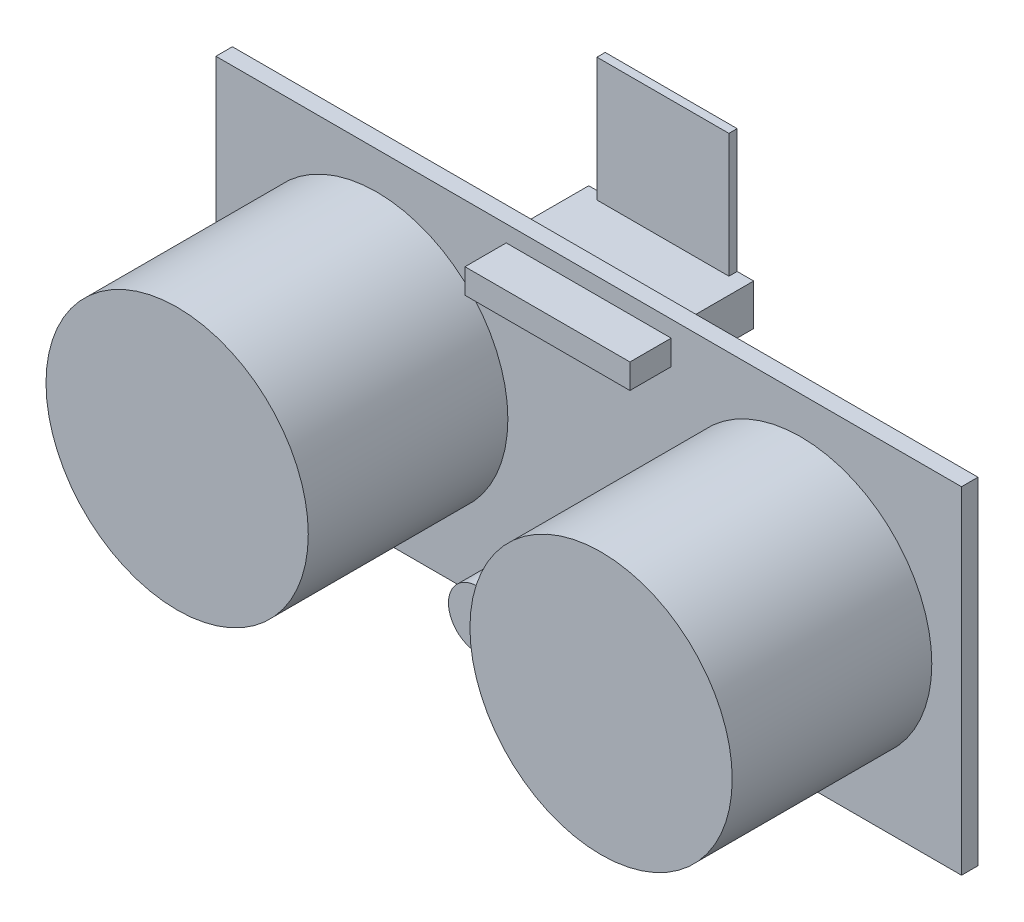
from build123d import *

# Parameters (mm, degrees)
ESBO_O1_W                = 45.2
ESBO_O1_H                = 20.4
RESSALTO_EXTRUS_O1_DEPTH = 1
ESBO_O2_R                = 7.95
RESSALTO_EXTRUS_O2_DEPTH = 12.1
ESBO_O3_W                = 10
ESBO_O3_H                = 3.5
RESSALTO_EXTRUS_O3_DEPTH = 3.5
FILETE1_R                = 1.75
ESBO_O4_W                = 10
ESBO_O4_H                = 2.5
RESSALTO_EXTRUS_O4_DEPTH = 4
ESBO_O5_W                = 8
ESBO_O5_H                = 0.5
RESSALTO_EXTRUS_O5_DEPTH = 7.5
ESBO_O7_W                = 10
ESBO_O7_H                = 1.5
RESSALTO_EXTRUS_O6_DEPTH = 2.5


with BuildPart() as part:
    # Esboço1 → Ressalto-extrusão1 (new body)
    with BuildSketch(Plane.XY):
        with Locations((22.6, 10.2)):
            Rectangle(ESBO_O1_W, ESBO_O1_H)
    extrude(amount=RESSALTO_EXTRUS_O1_DEPTH)

    # Esboço2 → Ressalto-extrusão2 (add)
    with BuildSketch(Plane.XY.offset(1)):
        with Locations(Location((9.75, 10.2, 0), (0, 0, 180))):
            Circle(ESBO_O2_R)
        with Locations(Location((35.45, 10.2, 0), (0, 0, 180))):
            Circle(ESBO_O2_R)
    extrude(amount=RESSALTO_EXTRUS_O2_DEPTH)

    # Esboço3 → Ressalto-extrusão3 (add)
    with BuildSketch(Plane.XY.offset(1)):
        with Locations((22.6, 2.25)):
            Rectangle(ESBO_O3_W, ESBO_O3_H)
    extrude(amount=RESSALTO_EXTRUS_O3_DEPTH)

    # Filete1
    filete1_edges = [part.edges().sort_by_distance(p)[0] for p in [
        (27.6, 0.5, 2.75),
        (27.6, 4, 2.75),
        (17.6, 4, 2.75),
        (17.6, 0.5, 2.75),
    ]]
    fillet(filete1_edges, radius=FILETE1_R - 0.0001)  # a hair under: the kernel refuses the full size

    # Esboço4 → Ressalto-extrusão4 (add)
    with BuildSketch(Plane(origin=(0, 0, 0), x_dir=(-1, 0, 0), z_dir=(0, 0, -1))):
        with Locations((-22.6, 18.651439954)):
            Rectangle(ESBO_O4_W, ESBO_O4_H)
    extrude(amount=RESSALTO_EXTRUS_O4_DEPTH)

    # Esboço5 → Ressalto-extrusão5 (add)
    with BuildSketch(Plane(origin=(0, 19.901439954, 0), x_dir=(1, 0, 0), z_dir=(0, 1, 0))):
        with Locations((22.6, 3.75)):
            Rectangle(ESBO_O5_W, ESBO_O5_H)
    extrude(amount=RESSALTO_EXTRUS_O5_DEPTH)

    # Esboço7 → Ressalto-extrusão6 (add)
    with BuildSketch(Plane.XY.offset(1)):
        with Locations((22.6, 18.65)):
            Rectangle(ESBO_O7_W, ESBO_O7_H)
    extrude(amount=RESSALTO_EXTRUS_O6_DEPTH)


solid = part.part
